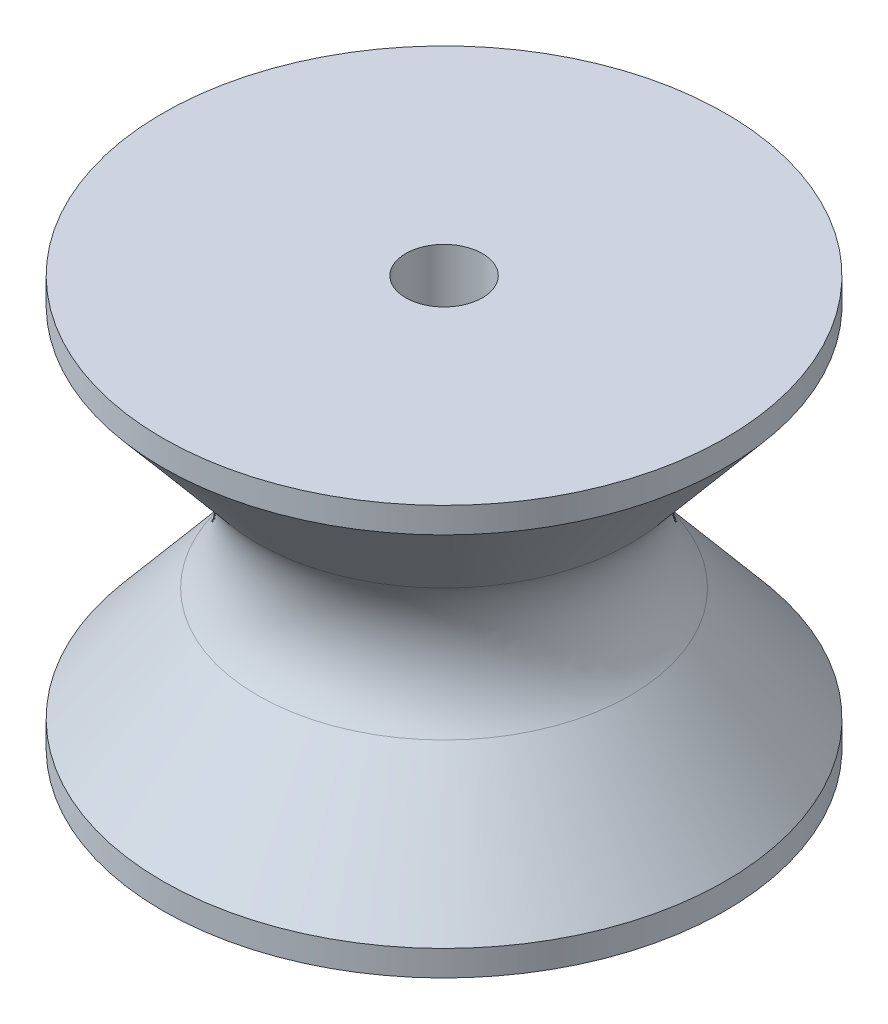
from build123d import *


with BuildPart() as part:
    # Esquisse1 → Révolution1 (revolve)
    with BuildSketch(Plane.XY):
        with BuildLine():
            Line((-0.75, -4), (-0.75, 4))
            Line((-0.75, 4), (-5.5, 4))
            Line((-5.5, 4), (-5.5, 3.5))
            Line((-5.5, 3.5), (-3.641876983, 1.285575219))
            ThreePointArc((-3.641876983, 1.285575219), (-3.17396587, 0), (-3.641876983, -1.285575219))
            Line((-3.641876983, -1.285575219), (-5.5, -3.5))
            Line((-5.5, -3.5), (-5.5, -4))
            Line((-5.5, -4), (-0.75, -4))
        make_face()
    revolve(axis=Axis((0, 4, 0), (0, -1, 0)))


solid = part.part
